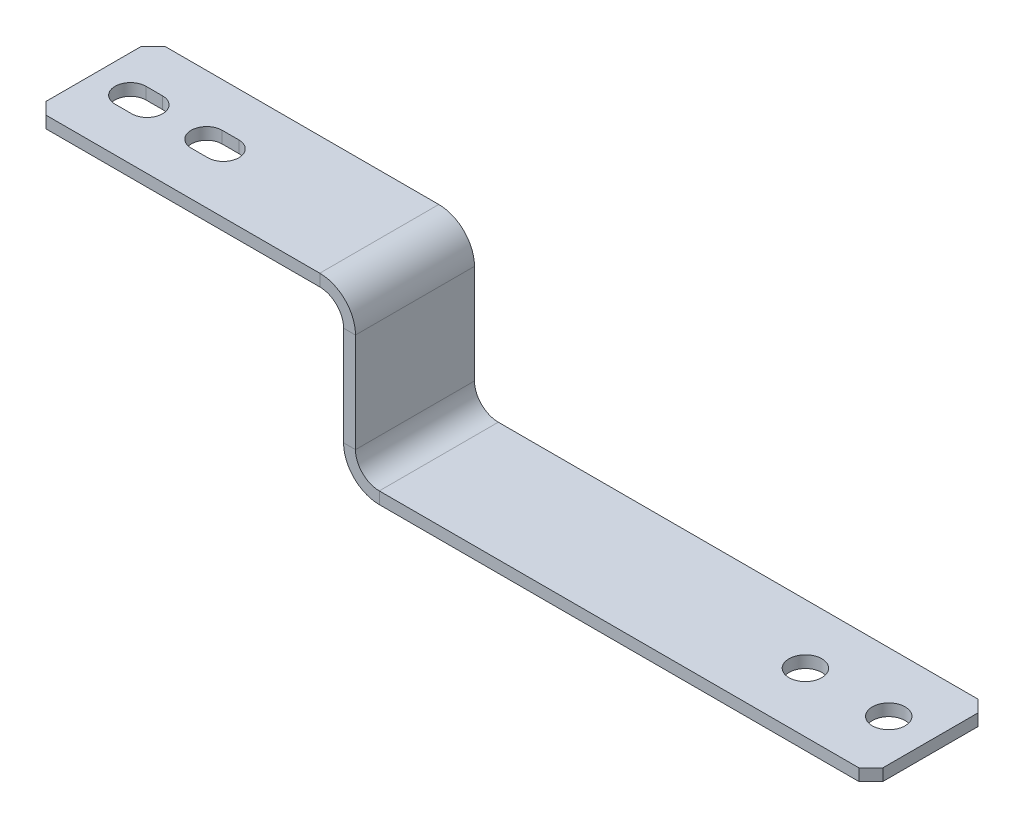
from build123d import *

# Parameters (mm, degrees)
SM_BASE_FLANGE_1_DEPTH = 50
SKETCH_3_R             = 6.9
CUT_EXTRUDE_2_DEPTH    = 10
OTHER_1_DEPTH          = 71.7
CUT_EXTRUDE_3_DEPTH    = 10


# Read off the part's stored shape, not the designer's step: Затупленный угол1
# Sheet-metal steps are written as plain solids
with BuildPart() as part:
    # Sketch 1 → Базовая кромка1 (new body)
    with BuildSketch(Plane.XY):
        with BuildLine():
            Line((-351.5, 66.7), (-231.5, 66.7))
            ThreePointArc((-231.5, 66.7), (-224.428932188, 63.771067812), (-221.5, 56.7))
            Line((-221.5, 56.7), (-221.5, 15))
            ThreePointArc((-221.5, 15), (-217.106601718, 4.393398282), (-206.5, 0))
            Line((-206.5, 0), (0, 0))
            Line((0, 0), (0, 5))
            Line((0, 5), (-206.5, 5))
            ThreePointArc((-206.5, 5), (-213.571067812, 7.928932188), (-216.5, 15))
            Line((-216.5, 15), (-216.5, 56.7))
            ThreePointArc((-216.5, 56.7), (-220.893398282, 67.306601718), (-231.5, 71.7))
            Line((-231.5, 71.7), (-351.5, 71.7))
            Line((-351.5, 71.7), (-351.5, 66.7))
        make_face()
    extrude(amount=SM_BASE_FLANGE_1_DEPTH)

    # Эскиз3 → Вырез-Вытянуть2 (cut)
    with BuildSketch(Plane(origin=(0, 5, 0), x_dir=(1, 0, 0), z_dir=(0, 1, 0))):
        with Locations(Location((-17.5, -25, 0), (0, 0, 270))):
            Circle(SKETCH_3_R)
        with Locations(Location((-52.5, -25, 0), (0, 0, 270))):
            Circle(SKETCH_3_R)
    extrude(amount=-CUT_EXTRUDE_2_DEPTH, mode=Mode.SUBTRACT)

    # Other 1 outline → Other 1 (cut)
    with BuildSketch(Plane(origin=(0, 0, 0), x_dir=(1, 0, 0), z_dir=(0, 1, 0))):
        Polygon((0, 0), (-5, 0), (0, -5), align=None)
        Polygon((0, -50), (0, -45), (-5, -50), align=None)
        Polygon((-346.5, -50), (-351.5, -45), (-351.5, -50), align=None)
        Polygon((-351.5, -5), (-346.5, 0), (-351.5, 0), align=None)
    extrude(amount=OTHER_1_DEPTH, mode=Mode.SUBTRACT)

    # Эскиз4 → Вырез-Вытянуть3 (cut)
    with BuildSketch(Plane.XZ.offset(-66.7)):
        with BuildLine():
            Line((-329, 18.5), (-336, 18.5))
            ThreePointArc((-336, 18.5), (-342.5, 25), (-336, 31.5))
            Line((-336, 31.5), (-329, 31.5))
            ThreePointArc((-329, 31.5), (-322.5, 25), (-329, 18.5))
        make_face()
        with BuildLine():
            Line((-297, 18.5), (-304, 18.5))
            ThreePointArc((-304, 18.5), (-310.5, 25), (-304, 31.5))
            Line((-304, 31.5), (-297, 31.5))
            ThreePointArc((-297, 31.5), (-290.5, 25), (-297, 18.5))
        make_face()
    extrude(amount=-CUT_EXTRUDE_3_DEPTH, mode=Mode.SUBTRACT)


solid = part.part
